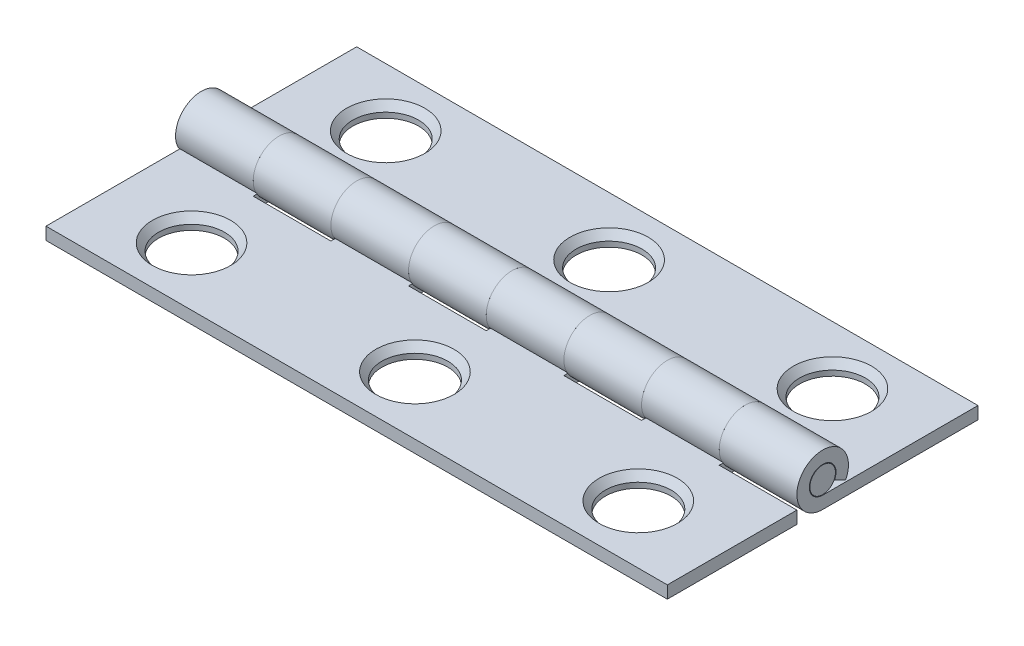
from build123d import *

# Parameters (mm, degrees)
BOSS_EXTRUDE1_DEPTH     = 25.4
SKETCH4_W               = 6.35
SKETCH4_H               = 4.2164
CUT_EXTRUDE1_DEPTH      = 29.476209496
LPATTERN1_COUNT         = 6
LPATTERN1_PITCH         = 12.7
CUT_EXTRUDE3_DEPTH      = 29.476209496
CUT_EXTRUDE3_DEPTH_BACK = 29.476209496
SKETCH9_R               = 2.6924
CIRPATTERN1_COUNT       = 2
SKETCH6_R               = 1.0922
BOSS_EXTRUDE2_DEPTH     = 25.4
CHAMFER1_SIZE           = 0.043688


with BuildPart() as part:
    # Sketch3 → Boss-Extrude1 (new, symmetric)
    with BuildSketch(Plane(origin=(0, 0, 0), x_dir=(0, 0, -1), z_dir=(1, 0, 0))):
        with BuildLine():
            Line((0, -2.1082), (-12.7, -2.1082))
            Line((-12.7, -2.1082), (-12.7, -1.0922))
            Line((-12.7, -1.0922), (0, -1.0922))
            ThreePointArc((0, -1.0922), (0.567521205, 0.933177647), (-0.96978228, -0.502417326))
            Line((-0.96978228, -0.502417326), (-1.871905331, -0.96978228))
            ThreePointArc((-1.871905331, -0.96978228), (1.095447908, 1.801249878), (0, -2.1082))
        make_face()
    extrude(amount=BOSS_EXTRUDE1_DEPTH, both=True)

    # Sketch4 → Cut-Extrude1 (cut, symmetric)
    with BuildSketch(Plane(origin=(0, 0, 0), x_dir=(1, 0, 0), z_dir=(0, 1, 0))):
        with Locations((-15.875, 0)):
            Rectangle(SKETCH4_W, SKETCH4_H)
    cut_extrude1 = extrude(amount=CUT_EXTRUDE1_DEPTH, both=True, mode=Mode.SUBTRACT)

    # LPattern1: Cut-Extrude1 ×6
    with Locations(*[(i * LPATTERN1_PITCH, 0, 0) for i in range(1, LPATTERN1_COUNT)]):
        add(cut_extrude1, mode=Mode.SUBTRACT)

    # Cut-Extrude2 cone 1 section (through the dimple's axis) → Cut-Extrude2 (revolve, cut)
    with BuildSketch(Plane(origin=(18.2626, -1.0922, 7.9375), x_dir=(0, 0, 1), z_dir=(1, 0, 0))):
        Polygon((0, 0), (3.2004, 0), (0, 3.68163905), align=None)
    revolve(axis=Axis((18.2626, -1.0922, 7.9375), (0, -1, 0)), mode=Mode.SUBTRACT)

    # Cut-Extrude2 cone 2 section (through the dimple's axis) → Cut-Extrude2 cone 2 (revolve, cut)
    with BuildSketch(Plane(origin=(0, -1.0922, 7.9375), x_dir=(0, 0, 1), z_dir=(1, 0, 0))):
        Polygon((0, 0), (3.2004, 0), (0, 3.68163905), align=None)
    revolve(axis=Axis((0, -1.0922, 7.9375), (0, -1, 0)), mode=Mode.SUBTRACT)

    # Cut-Extrude2 cone 3 section (through the dimple's axis) → Cut-Extrude2 cone 3 (revolve, cut)
    with BuildSketch(Plane(origin=(-18.2626, -1.0922, 7.9375), x_dir=(0, 0, 1), z_dir=(1, 0, 0))):
        Polygon((0, 0), (3.2004, 0), (0, 3.68163905), align=None)
    revolve(axis=Axis((-18.2626, -1.0922, 7.9375), (0, -1, 0)), mode=Mode.SUBTRACT)

    # Sketch9 → Cut-Extrude3 (cut, two sides: drawn at the far end of the back side and taken through both)
    with BuildSketch(Plane(origin=(0, 0, 0), x_dir=(1, 0, 0), z_dir=(0, 1, 0)).offset(-CUT_EXTRUDE3_DEPTH_BACK)):
        with Locations((18.2626, -7.9375)):
            Circle(SKETCH9_R)
        with Locations((0, -7.9375)):
            Circle(SKETCH9_R)
        with Locations((-18.2626, -7.9375)):
            Circle(SKETCH9_R)
    extrude(amount=CUT_EXTRUDE3_DEPTH + CUT_EXTRUDE3_DEPTH_BACK, mode=Mode.SUBTRACT)


with BuildPart() as cirpattern1_1:
    # CirPattern1: pattern copy
    add(part.part.rotate(Axis((0, 1.0922, 0), (0, -1, 0)), 1 * 360 / CIRPATTERN1_COUNT))


with BuildPart() as body_3:
    # Sketch6 → Boss-Extrude2 (new, symmetric)
    with BuildSketch(Plane(origin=(0, 0, 0), x_dir=(0, 0, -1), z_dir=(1, 0, 0))):
        Circle(SKETCH6_R)
    extrude(amount=BOSS_EXTRUDE2_DEPTH, both=True)

    # Chamfer1
    chamfer1_edges = [body_3.edges().sort_by_distance(p)[0] for p in [
        (25.4, 0, 1.0922),
        (-25.4, 0, 1.0922),
    ]]
    chamfer(chamfer1_edges, length=CHAMFER1_SIZE)


solid = Compound([part.part, cirpattern1_1.part, body_3.part])
